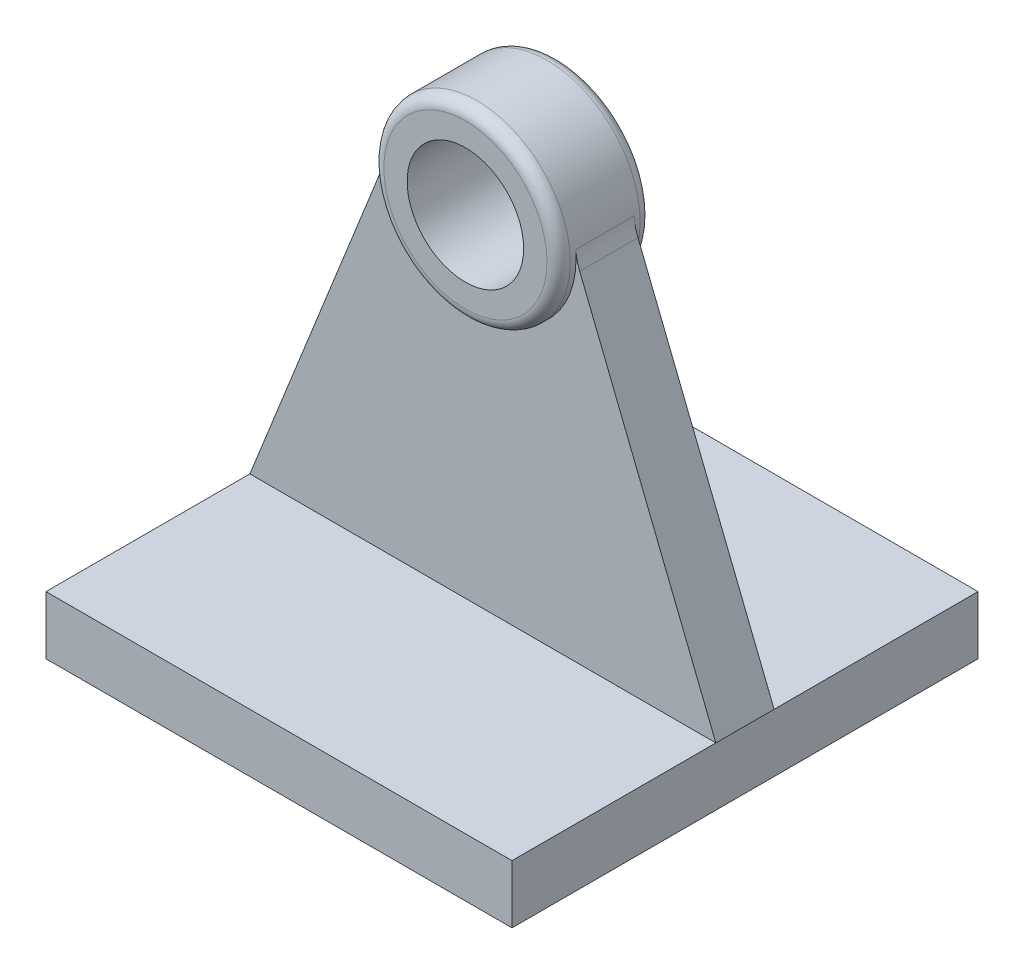
from build123d import *

# Parameters (mm, degrees)
SKETCH1_W           = 50.8
SKETCH1_H           = 50.8
BOSS_EXTRUDE1_DEPTH = 6.35
SKETCH2_R           = 10.16
SKETCH2_R_2         = 6.35
BOSS_EXTRUDE2_DEPTH = 5.08
BOSS_EXTRUDE3_DEPTH = 3.175
FILLET3_R           = 6.35


with BuildPart() as part:
    # Sketch1 → Boss-Extrude1 (new body)
    with BuildSketch(Plane(origin=(0, 0, 0), x_dir=(1, 0, 0), z_dir=(0, 1, 0))):
        Rectangle(SKETCH1_W, SKETCH1_H)
    extrude(amount=BOSS_EXTRUDE1_DEPTH)



with BuildPart() as body_2:
    # Sketch2 → Boss-Extrude2 (new, symmetric)
    with BuildSketch(Plane.XY):
        with Locations((0, 44.45)):
            Circle(SKETCH2_R)
        with Locations((0, 44.45)):
            Circle(SKETCH2_R_2, mode=Mode.SUBTRACT)
    extrude(amount=BOSS_EXTRUDE2_DEPTH, both=True)


with BuildPart() as part_1:
    add(part.part)

    add(body_2.part)  # Boss-Extrude3 merges body 2
    # Sketch4 → Boss-Extrude3 (add, symmetric)
    with BuildSketch(Plane.XY):
        with BuildLine():
            Line((-10.16, 44.45), (-25.4, 6.35))
            Line((-25.4, 6.35), (25.4, 6.35))
            Line((25.4, 6.35), (10.16, 44.45))
            ThreePointArc((10.16, 44.45), (0, 34.29), (-10.16, 44.45))
        make_face()
    extrude(amount=BOSS_EXTRUDE3_DEPTH, both=True)

    # Fillet2: read off the stored shape, not the designer's step
    # Fillet2 outline → Fillet2 (revolve, cut)
    with BuildSketch(Plane.XZ.offset(-44.45)):
        with BuildLine():
            ThreePointArc((10.16, -3.81), (9.788025612, -4.708025612), (8.89, -5.08))
            Line((8.89, -5.08), (10.16, -5.08))
            Line((10.16, -5.08), (10.16, -3.81))
        make_face()
        with BuildLine():
            ThreePointArc((8.89, 5.08), (9.788025612, 4.708025612), (10.16, 3.81))
            Line((10.16, 3.81), (10.16, 5.08))
            Line((10.16, 5.08), (8.89, 5.08))
        make_face()
    revolve(axis=Axis((0, 44.45, 0), (0, 0, 1)), mode=Mode.SUBTRACT)

    # Fillet3
    # the kernel refuses this fillet: 6.35 mm, written as the material it adds along each edge
    with BuildSketch(Plane(origin=(10.16, 44.45, 3.175), x_dir=(-0.041343675933645734, 0.9991449847045691, 0), z_dir=(0, 0, -1))) as fillet3_piece_1:
        with BuildLine():
            CenterArc((1.102635837, 6.344570653), FILLET3_R, 250.56808401, 17.062422493)
            Line((-1.009923388, 0.356282624), (0, 0))
            ThreePointArc((0, 0), (0.420051747, 0.008686955), (0.840103495, 0))
        make_face()
    extrude(amount=6.35)
    with BuildSketch(Plane(origin=(-10.16, 44.45, 3.175), x_dir=(0.04134367593364538, 0.9991449847045691, 0), z_dir=(0, 0, -1))) as fillet3_piece_2:
        with BuildLine():
            CenterArc((1.102635837, -6.344570653), FILLET3_R, 92.369493497, 17.062422493)
            Line((-1.009923388, -0.356282624), (0, 0))
            ThreePointArc((0, 0), (0.420051747, -0.008686955), (0.840103495, 0))
        make_face()
    extrude(amount=6.35)


solid = part_1.part
